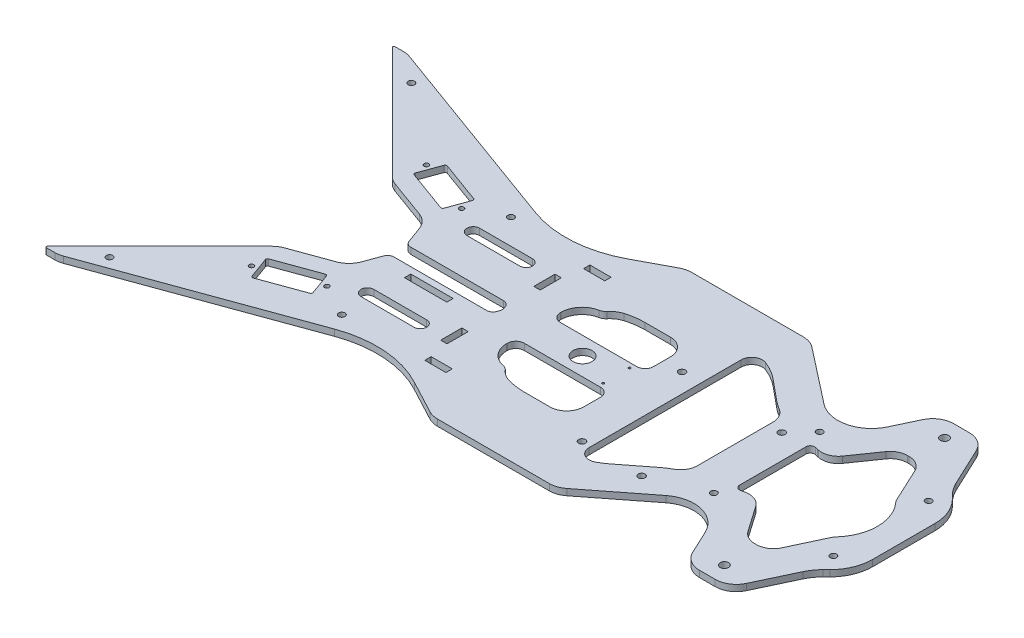
from build123d import *

# Parameters (mm, degrees)
BOSS_EXTRUDE1_DEPTH        = 3
CUT_EXTRUDE1_DEPTH         = 227.615470034
CUT_EXTRUDE2_DEPTH         = 227.615470034
CUT_EXTRUDE3_DEPTH         = 227.615470034
CUT_EXTRUDE4_DEPTH         = 227.615470034
CUT_EXTRUDE5_DEPTH         = 227.615470034
CUT_EXTRUDE6_DEPTH         = 227.615470034
CUT_EXTRUDE7_DEPTH         = 227.615470034
CUT_EXTRUDE8_DEPTH         = 227.615470165
DRAFT1_ANGLE               = 25.050574566
DRAFT2_ANGLE               = 25.050574566
DRAFT3_ANGLE               = 45
F_9_0_9_DIAMETER_HOLE1_D   = 9
F_1_0_1_DIAMETER_HOLE1_D   = 1
F_3_2_3_2_DIAMETER_HOLE1_D = 3.2
F_3_0_3_DIAMETER_HOLE1_D   = 3
FILLET1_R                  = 2
FILLET2_DEPTH              = 5
FILLET2_START              = 1
FILLET2_2_DEPTH            = 3
FILLET3_R                  = 8
FILLET4_R                  = 10
FILLET5_R                  = 16
FILLET6_R                  = 20
FILLET7_R                  = 10
CUT_EXTRUDE10_DEPTH        = 227.615470165
CUT_EXTRUDE10_DEPTH_BACK   = 227.615470165
FILLET8_R                  = 3
FILLET9_R                  = 10
FILLET10_R                 = 0.5
CUT_EXTRUDE11_DEPTH        = 226.956841552
CUT_EXTRUDE11_DEPTH_BACK   = 226.956841552
SKETCH21_R                 = 1.1
CUT_EXTRUDE12_DEPTH        = 226.956841552
CUT_EXTRUDE12_DEPTH_BACK   = 226.956841552
SKETCH22_W                 = 20
SKETCH22_H                 = 3
FILLET11_R                 = 50
CUT_EXTRUDE13_DEPTH        = 226.956841552
CUT_EXTRUDE13_DEPTH_BACK   = 226.956841552
SKETCH23_W                 = 10
SKETCH23_H                 = 3
F_4_0_4_DIAMETER_HOLE1_D   = 4
CUT_EXTRUDE14_DEPTH        = 226.956841552
CUT_EXTRUDE14_DEPTH_BACK   = 226.956841552
SKETCH24_W                 = 3
SKETCH24_H                 = 10
CUT_EXTRUDE15_DEPTH        = 226.956841552
CUT_EXTRUDE15_DEPTH_BACK   = 226.956841552


with BuildPart() as part:
    # Sketch1 → Boss-Extrude1 (new body)
    with BuildSketch(Plane(origin=(0, 4, 0), x_dir=(1, 0, 0), z_dir=(0, 1, 0))):
        Polygon((-50, -60), (112.705882353, -60), (112.705882353, 60), (-50, 60), (-87.746184306, 39.929997795), (-204.125873456, 82.288740519), (-211.125873456, 82.288740519), (-155.729656663, 26.892523726), (-131.297648523, 18), (-124.746184306, 0), (-131.297648523, -18), (-155.729656663, -26.892523726), (-211.125873456, -82.288740519), (-204.125873456, -82.288740519), (-87.746184306, -39.929997795), align=None)
    extrude(amount=-BOSS_EXTRUDE1_DEPTH)

    # Sketch2 → Cut-Extrude1 (cut, through all)
    with BuildSketch(Plane.XZ.offset(-1)):
        Polygon((107.411764706, -23), (90, -60), (112.705882353, -60), (112.705882353, -23), align=None)
    extrude(amount=-CUT_EXTRUDE1_DEPTH, mode=Mode.SUBTRACT)

    # Sketch3 → Cut-Extrude2 (cut, through all)
    with BuildSketch(Plane.XZ.offset(-1)):
        Polygon((8.731454638, -60), (70, -60), (53.529411765, -25), align=None)
    extrude(amount=-CUT_EXTRUDE2_DEPTH, mode=Mode.SUBTRACT)

    # Sketch4 → Cut-Extrude3 (cut, through all)
    with BuildSketch(Plane.XZ.offset(-1)):
        Polygon((70, 60), (8.731454638, 60), (53.529411765, 25), align=None)
    extrude(amount=-CUT_EXTRUDE3_DEPTH, mode=Mode.SUBTRACT)

    # Sketch5 → Cut-Extrude4 (cut, through all)
    with BuildSketch(Plane.XZ.offset(-1)):
        Polygon((90, 60), (107.411764706, 23), (112.705882353, 23), (112.705882353, 60), align=None)
    extrude(amount=-CUT_EXTRUDE4_DEPTH, mode=Mode.SUBTRACT)

    # Sketch6 → Cut-Extrude5 (cut, through all)
    with BuildSketch(Plane(origin=(0, 4, 0), x_dir=(-1, 0, 0), z_dir=(0, 1, 0))):
        with BuildLine():
            Line((50.659688499, 22.709443341), (50.659688499, 25.709443341))
            ThreePointArc((50.659688499, 25.709443341), (44.497922205, 27.791400904), (38.032255864, 28.496432757))
            Line((38.032255864, 28.496432757), (17.909623138, 28.496432757))
            Line((17.909623138, 28.496432757), (17.909623138, 8.5))
            Line((17.909623138, 8.5), (62, 8.5))
            Line((62, 8.5), (62, 12.799672149))
            ThreePointArc((62, 12.799672149), (58.580155203, 20.329715808), (50.659688499, 22.709443341))
        make_face()
    extrude(amount=-CUT_EXTRUDE5_DEPTH, mode=Mode.SUBTRACT)

    # Sketch7 → Cut-Extrude6 (cut, through all)
    with BuildSketch(Plane(origin=(0, 4, 0), x_dir=(-1, 0, 0), z_dir=(0, 1, 0))):
        with BuildLine():
            Line((17.909623138, -28.496432757), (38.032255864, -28.496432757))
            ThreePointArc((38.032255864, -28.496432757), (44.497922205, -27.791400904), (50.659688499, -25.709443341))
            Line((50.659688499, -25.709443341), (50.659688499, -22.709443341))
            ThreePointArc((50.659688499, -22.709443341), (58.580155203, -20.329715808), (62, -12.799672149))
            Line((62, -12.799672149), (62, -8.5))
            Line((62, -8.5), (17.909623138, -8.5))
            Line((17.909623138, -8.5), (17.909623138, -28.496432757))
        make_face()
    extrude(amount=-CUT_EXTRUDE6_DEPTH, mode=Mode.SUBTRACT)

    # Sketch8 → Cut-Extrude7 (cut, through all)
    with BuildSketch(Plane(origin=(0, 4, 0), x_dir=(-1, 0, 0), z_dir=(0, 1, 0))):
        with BuildLine():
            Line((-84.322269003, -36.050766636), (-74.158552751, -36.050766636))
            Line((-74.158552751, -36.050766636), (-60.709453846, -16.741978087))
            ThreePointArc((-60.709453846, -16.741978087), (-57.653175169, -16.898064794), (-54.628699458, -17.36470071))
            Line((-54.628699458, -17.36470071), (-50.879804697, -18.140678279))
            Line((-50.879804697, -18.140678279), (-50.879804697, 18.140678279))
            Line((-50.879804697, 18.140678279), (-54.628699458, 17.36470071))
            ThreePointArc((-54.628699458, 17.36470071), (-57.653175169, 16.898064794), (-60.709453846, 16.741978087))
            Line((-60.709453846, 16.741978087), (-74.158552751, 36.050766636))
            Line((-74.158552751, 36.050766636), (-84.322269003, 36.050766636))
            Line((-84.322269003, 36.050766636), (-84.322269003, 20.135669333))
            add(Edge.make_bspline(
                [(-84.322269003, 20.135669333), (-100.328278009, 16.605046691), (-100.328278009, 0), (-100.328278009, -16.605046691), (-84.322269003, -20.135669333)],
                knots=[0.21425904, 0.21425904, 0.21425904, 1.570796327, 1.570796327, 2.927333613, 2.927333613, 2.927333613], degree=2, weights=[1, 0.778660218, 1, 0.778660218, 1]))
            Line((-84.322269003, -20.135669333), (-84.322269003, -36.050766636))
        make_face()
    extrude(amount=-CUT_EXTRUDE7_DEPTH, mode=Mode.SUBTRACT)

    # Sketch9 → Cut-Extrude8 (cut, through all)
    with BuildSketch(Plane.XZ.offset(-1)):
        with BuildLine():
            Line((15.40397607, -35.623674709), (25.277169215, -27.477931907))
            ThreePointArc((25.277169215, -27.477931907), (28.964293927, -24.875948555), (33, -22.856472758))
            Line((33, -22.856472758), (33, 22.856472758))
            ThreePointArc((33, 22.856472758), (28.620977388, 24.827106443), (24.612474198, 27.471182525))
            Line((24.612474198, 27.471182525), (11.899553473, 37.403604758))
            ThreePointArc((11.899553473, 37.403604758), (9.674064026, 38.984720188), (7.314058157, 40.356981674))
            ThreePointArc((7.314058157, 40.356981674), (2.40869635, 40.200811771), (0, 35.92469842))
            Line((0, 35.92469842), (0, -35.92469842))
            ThreePointArc((0, -35.92469842), (2.144129946, -40.028843427), (6.737602495, -40.613060348))
            ThreePointArc((6.737602495, -40.613060348), (11.280144445, -38.482009504), (15.40397607, -35.623674709))
        make_face()
    extrude(amount=-CUT_EXTRUDE8_DEPTH, mode=Mode.SUBTRACT)

    # Draft1
    draft1_faces = [part.faces().sort_by_distance(p)[0] for p in [
        (84.322269003, 2.5, 28.093217985),
    ]]
    draft(draft1_faces, Plane(origin=(74.158552751, 1, 36.050766636), x_dir=(0, -1, 0), z_dir=(0, 0, -1)), DRAFT1_ANGLE)

    # Draft2
    draft2_faces = [part.faces().sort_by_distance(p)[0] for p in [
        (84.322269003, 2.5, -28.093217985),
    ]]
    draft(draft2_faces, Plane(origin=(84.322269003, 1, -36.050766636), x_dir=(1, 0, 0), z_dir=(0, 0, 1)), DRAFT2_ANGLE)

    # Draft3
    draft3_faces = [part.faces().sort_by_distance(p)[0] for p in [
        (110.058823529, 2.5, 23),
        (110.058823529, 2.5, -23),
    ]]
    draft(draft3_faces, Plane(origin=(112.705882353, 1, 60), x_dir=(0, 0, 1), z_dir=(1, 0, 0)), DRAFT3_ANGLE)

    # Ø9.0 (9) Diameter Hole1 (through all)
    with Locations(Plane(origin=(0, 1, 0), x_dir=(-1, 0, 0), z_dir=(0, -1, 0))):
        with Locations((39, 0)):
            Hole(F_9_0_9_DIAMETER_HOLE1_D / 2)

    # Ø1.0 (1) Diameter Hole1 (through all)
    with Locations(Plane(origin=(0, 4, 0), x_dir=(1, 0, 0), z_dir=(0, 1, 0))):
        with Locations((-23, 6.25), (-23, -6.25)):
            Hole(F_1_0_1_DIAMETER_HOLE1_D / 2)

    # Ø3.2 (3.2) Diameter Hole1 (through all)
    with Locations(Plane(origin=(0, 1, 0), x_dir=(-1, 0, 0), z_dir=(0, -1, 0))):
        with Locations((4.18, -35.06), (-23.99, -35.06), (-39.32, 15.75), (9, 17)):
            Hole(F_3_2_3_2_DIAMETER_HOLE1_D / 2)

    # Ø3.0 (3) Diameter Hole1 (through all)
    with Locations(Plane(origin=(0, 1, 0), x_dir=(-1, 0, 0), z_dir=(0, -1, 0))):
        with Locations((-102, -22.5), (-48, 25), (-102, 22.5), (191.125873456, 71.288740519), (191.125873456, -71.288740519), (-48, -25), (112.746184306, 39.929997795), (112.746184306, -39.929997795)):
            Hole(F_3_0_3_DIAMETER_HOLE1_D / 2)

    # Fillet1
    fillet1_edges = [part.edges().sort_by_distance(p)[0] for p in [
        (50.879804697, 2.5, 18.140678279),
        (50.879804697, 2.5, -18.140678279),
    ]]
    fillet(fillet1_edges, radius=FILLET1_R)

    # Fillet2: read off the stored shape, not the designer's step
    # Fillet2 outline → Fillet2 (cut)
    with BuildSketch(Plane(origin=(0, 0, 0), x_dir=(1, 0, 0), z_dir=(0, 1, 0))):
        with BuildLine():
            ThreePointArc((-50.659688499, 25.709443341), (-51.782597158, 23.691120977), (-53.834096965, 22.630037774))
            ThreePointArc((-53.834096965, 22.630037774), (-52.250064656, 22.796545043), (-50.659688499, 22.709443341))
            Line((-50.659688499, 22.709443341), (-50.659688499, 25.709443341))
        make_face()
        with BuildLine():
            ThreePointArc((-53.834096965, -22.630037774), (-51.782597158, -23.691120977), (-50.659688499, -25.709443341))
            Line((-50.659688499, -25.709443341), (-50.659688499, -22.709443341))
            ThreePointArc((-50.659688499, -22.709443341), (-52.250064656, -22.796545043), (-53.834096965, -22.630037774))
        make_face()
    extrude(amount=FILLET2_DEPTH, mode=Mode.SUBTRACT)

    # Fillet2 2 outline → Fillet2 2 (add)
    with BuildSketch(Plane(origin=(0, 0, 0), x_dir=(1, 0, 0), z_dir=(0, 1, 0)).offset(FILLET2_START)):
        with BuildLine():
            ThreePointArc((-17.909623138, 12.5), (-19.081196014, 9.671572876), (-21.909623138, 8.5))
            Line((-21.909623138, 8.5), (-17.909623138, 8.5))
            Line((-17.909623138, 8.5), (-17.909623138, 12.5))
        make_face()
        with BuildLine():
            ThreePointArc((-58, 8.5), (-60.828427125, 9.671572875), (-62, 12.5))
            Line((-62, 12.5), (-62, 8.5))
            Line((-62, 8.5), (-58, 8.5))
        make_face()
        with BuildLine():
            Line((-17.909623138, -8.5), (-21.909623138, -8.5))
            ThreePointArc((-21.909623138, -8.5), (-19.081196014, -9.671572876), (-17.909623138, -12.5))
            Line((-17.909623138, -12.5), (-17.909623138, -8.5))
        make_face()
        with BuildLine():
            Line((-62, -8.5), (-62, -12.5))
            ThreePointArc((-62, -12.5), (-60.828427125, -9.671572875), (-58, -8.5))
            Line((-58, -8.5), (-62, -8.5))
        make_face()
    extrude(amount=FILLET2_2_DEPTH)

    # Fillet3
    fillet3_edges = [part.edges().sort_by_distance(p)[0] for p in [
        (60.709453846, 2.5, -16.741978087),
        (74.158552751, 2.5, -36.050766636),
        (-17.909623138, 2.5, 28.496432757),
        (84.322269003, 2.5, -36.050766636),
        (60.709453846, 2.5, 16.741978087),
        (94.349899834, 2.5, -14.595907026),
        (33, 2.5, -22.856472758),
        (94.349899834, 2.5, 14.595907026),
        (33, 2.5, 22.856472758),
        (84.322269003, 2.5, 36.050766636),
        (74.158552751, 2.5, 36.050766636),
        (-17.909623138, 2.5, -28.496432757),
    ]]
    fillet(fillet3_edges, radius=FILLET3_R)

    # Fillet4
    fillet4_edges = [part.edges().sort_by_distance(p)[0] for p in [
        (-50.659688499, 2.5, 25.709443341),
        (-50.659688499, 2.5, -25.709443341),
        (-50, 2.5, -60),
        (-50, 2.5, 60),
        (90, 2.5, -60),
        (8.731454638, 2.5, -60),
        (70, 2.5, -60),
        (70, 2.5, 60),
        (8.731454638, 2.5, 60),
        (90, 2.5, 60),
    ]]
    fillet(fillet4_edges, radius=FILLET4_R)

    # Fillet5
    fillet5_edges = [part.edges().sort_by_distance(p)[0] for p in [
        (53.529411765, 2.5, -25),
        (53.529411765, 2.5, 25),
    ]]
    fillet(fillet5_edges, radius=FILLET5_R)

    # Fillet6
    fillet6_edges = [part.edges().sort_by_distance(p)[0] for p in [
        (102.705882353, 2.5, -33),
        (112.705882353, 2.5, -23),
        (112.705882353, 2.5, 23),
        (102.705882353, 2.5, 33),
    ]]
    fillet(fillet6_edges, radius=FILLET6_R)

    # Fillet7
    fillet7_edges = [part.edges().sort_by_distance(p)[0] for p in [
        (-155.729656663, 2.5, 26.892523726),
        (-131.297648523, 2.5, 18),
        (-131.297648523, 2.5, -18),
        (-155.729656663, 2.5, -26.892523726),
    ]]
    fillet(fillet7_edges, radius=FILLET7_R)

    # Sketch19 → Cut-Extrude10 (cut, two sides: drawn at the far end of the back side and taken through both)
    with BuildSketch(Plane.XZ.offset(-1).offset(-CUT_EXTRUDE10_DEPTH_BACK)):
        Polygon((-126.202065243, -4), (-78.202065243, -4), (-76.746184306, 0), (-78.202065243, 4), (-126.202065243, 4), (-124.746184306, 0), align=None)
    extrude(amount=CUT_EXTRUDE10_DEPTH + CUT_EXTRUDE10_DEPTH_BACK, mode=Mode.SUBTRACT)

    # Fillet8
    fillet8_edges = [part.edges().sort_by_distance(p)[0] for p in [
        (-126.202065243, 2.5, -4),
        (-126.202065243, 2.5, 4),
        (-78.202065243, 2.5, 4),
        (-76.746184306, 2.5, 0),
        (-78.202065243, 2.5, -4),
    ]]
    fillet(fillet8_edges, radius=FILLET8_R)

    # Fillet9
    fillet9_edges = [part.edges().sort_by_distance(p)[0] for p in [
        (-204.125873456, 2.5, 82.288740519),
        (-204.125873456, 2.5, -82.288740519),
    ]]
    fillet(fillet9_edges, radius=FILLET9_R)

    # Fillet10
    fillet10_edges = [part.edges().sort_by_distance(p)[0] for p in [
        (-211.125873456, 2.5, 82.288740519),
        (-211.125873456, 2.5, -82.288740519),
    ]]
    fillet(fillet10_edges, radius=FILLET10_R)

    # Sketch21 → Cut-Extrude11 (cut, two sides: drawn at the far end of the back side and taken through both)
    with BuildSketch(Plane(origin=(0, 4, 0), x_dir=(1, 0, 0), z_dir=(0, 1, 0)).offset(-CUT_EXTRUDE11_DEPTH_BACK)):
        with Locations(Location((-154.052059546, -41.286834903, 0), (0, 0, 270))):
            Circle(SKETCH21_R)
        with Locations(Location((-127.928604688, -31.778674918, 0), (0, 0, 90))):
            Circle(SKETCH21_R)
        with Locations(Location((-127.928604688, 31.778674918, 0), (0, 0, 270))):
            Circle(SKETCH21_R)
        with Locations(Location((-154.052059546, 41.286834903, 0), (0, 0, 90))):
            Circle(SKETCH21_R)
        with BuildLine():
            Line((-152.849458248, -34.357639414), (-133.303851735, -27.243620433))
            ThreePointArc((-133.303851735, -27.243620433), (-132.653909091, -27.271997542), (-132.214395886, -27.751642039))
            Line((-132.214395886, -27.751642039), (-128.623184381, -37.618414557))
            ThreePointArc((-128.623184381, -37.618414557), (-128.65156149, -38.268357201), (-129.131205987, -38.707870407))
            Line((-129.131205987, -38.707870407), (-148.676812499, -45.821889388))
            ThreePointArc((-148.676812499, -45.821889388), (-149.326755143, -45.793512279), (-149.766268349, -45.313867782))
            Line((-149.766268349, -45.313867782), (-153.357479853, -35.447095264))
            ThreePointArc((-153.357479853, -35.447095264), (-153.329102745, -34.797152619), (-152.849458248, -34.357639414))
        make_face()
        with BuildLine():
            Line((-149.766268349, 45.313867782), (-153.357479853, 35.447095264))
            ThreePointArc((-153.357479853, 35.447095264), (-153.329102745, 34.797152619), (-152.849458248, 34.357639414))
            Line((-152.849458248, 34.357639414), (-133.303851735, 27.243620433))
            ThreePointArc((-133.303851735, 27.243620433), (-132.653909091, 27.271997542), (-132.214395886, 27.751642039))
            Line((-132.214395886, 27.751642039), (-128.623184381, 37.618414557))
            ThreePointArc((-128.623184381, 37.618414557), (-128.65156149, 38.268357201), (-129.131205987, 38.707870407))
            Line((-129.131205987, 38.707870407), (-148.676812499, 45.821889388))
            ThreePointArc((-148.676812499, 45.821889388), (-149.326755143, 45.793512279), (-149.766268349, 45.313867782))
        make_face()
    extrude(amount=CUT_EXTRUDE11_DEPTH + CUT_EXTRUDE11_DEPTH_BACK, mode=Mode.SUBTRACT)

    # Sketch22 → Cut-Extrude12 (cut, two sides: drawn at the far end of the back side and taken through both)
    with BuildSketch(Plane(origin=(0, 4, 0), x_dir=(1, 0, 0), z_dir=(0, 1, 0)).offset(-CUT_EXTRUDE12_DEPTH_BACK)):
        with Locations((-103.101442628, -8.5)):
            Rectangle(SKETCH22_W, SKETCH22_H)
    extrude(amount=CUT_EXTRUDE12_DEPTH + CUT_EXTRUDE12_DEPTH_BACK, mode=Mode.SUBTRACT)

    # Fillet11
    fillet11_edges = [part.edges().sort_by_distance(p)[0] for p in [
        (-87.746184306, 2.5, -39.929997795),
        (-87.746184306, 2.5, 39.929997795),
    ]]
    fillet(fillet11_edges, radius=FILLET11_R)

    # Sketch23 → Cut-Extrude13 (cut, two sides: drawn at the far end of the back side and taken through both)
    with BuildSketch(Plane(origin=(0, 4, 0), x_dir=(1, 0, 0), z_dir=(0, 1, 0)).offset(-CUT_EXTRUDE13_DEPTH_BACK)):
        with Locations((-69.509270733, 37.5)):
            Rectangle(SKETCH23_W, SKETCH23_H)
        with Locations((-69.509270733, -37.5)):
            Rectangle(SKETCH23_W, SKETCH23_H)
    extrude(amount=CUT_EXTRUDE13_DEPTH + CUT_EXTRUDE13_DEPTH_BACK, mode=Mode.SUBTRACT)

    # Ø4.0 (4) Diameter Hole1 (through all)
    with Locations(Plane(origin=(80, 4, -52), x_dir=(0, 0, 1), z_dir=(0, 1, 0))):
        with Locations((0, 0), (104, 0)):
            Hole(F_4_0_4_DIAMETER_HOLE1_D / 2)

    # Sketch24 → Cut-Extrude14 (cut, two sides: drawn at the far end of the back side and taken through both)
    with BuildSketch(Plane(origin=(0, 4, 0), x_dir=(1, 0, 0), z_dir=(0, 1, 0)).offset(-CUT_EXTRUDE14_DEPTH_BACK)):
        with Locations((-77.5, 22)):
            Rectangle(SKETCH24_W, SKETCH24_H)
        with Locations((-77.5, -22)):
            Rectangle(SKETCH24_W, SKETCH24_H)
    extrude(amount=CUT_EXTRUDE14_DEPTH + CUT_EXTRUDE14_DEPTH_BACK, mode=Mode.SUBTRACT)

    # Sketch27 → Cut-Extrude15 (cut, two sides: drawn at the far end of the back side and taken through both)
    with BuildSketch(Plane(origin=(0, 4, 0), x_dir=(1, 0, 0), z_dir=(0, 1, 0)).offset(-CUT_EXTRUDE15_DEPTH_BACK)):
        with BuildLine():
            Line((-115.601442628, -22), (-90.601442628, -22))
            ThreePointArc((-90.601442628, -22), (-87.601442628, -25), (-90.601442628, -28))
            Line((-90.601442628, -28), (-115.601442628, -28))
            ThreePointArc((-115.601442628, -28), (-118.601442628, -25), (-115.601442628, -22))
        make_face()
        with BuildLine():
            Line((-115.601442628, 22), (-90.601442628, 22))
            ThreePointArc((-90.601442628, 22), (-87.601442628, 25), (-90.601442628, 28))
            Line((-90.601442628, 28), (-115.601442628, 28))
            ThreePointArc((-115.601442628, 28), (-118.601442628, 25), (-115.601442628, 22))
        make_face()
    extrude(amount=CUT_EXTRUDE15_DEPTH + CUT_EXTRUDE15_DEPTH_BACK, mode=Mode.SUBTRACT)


solid = part.part
